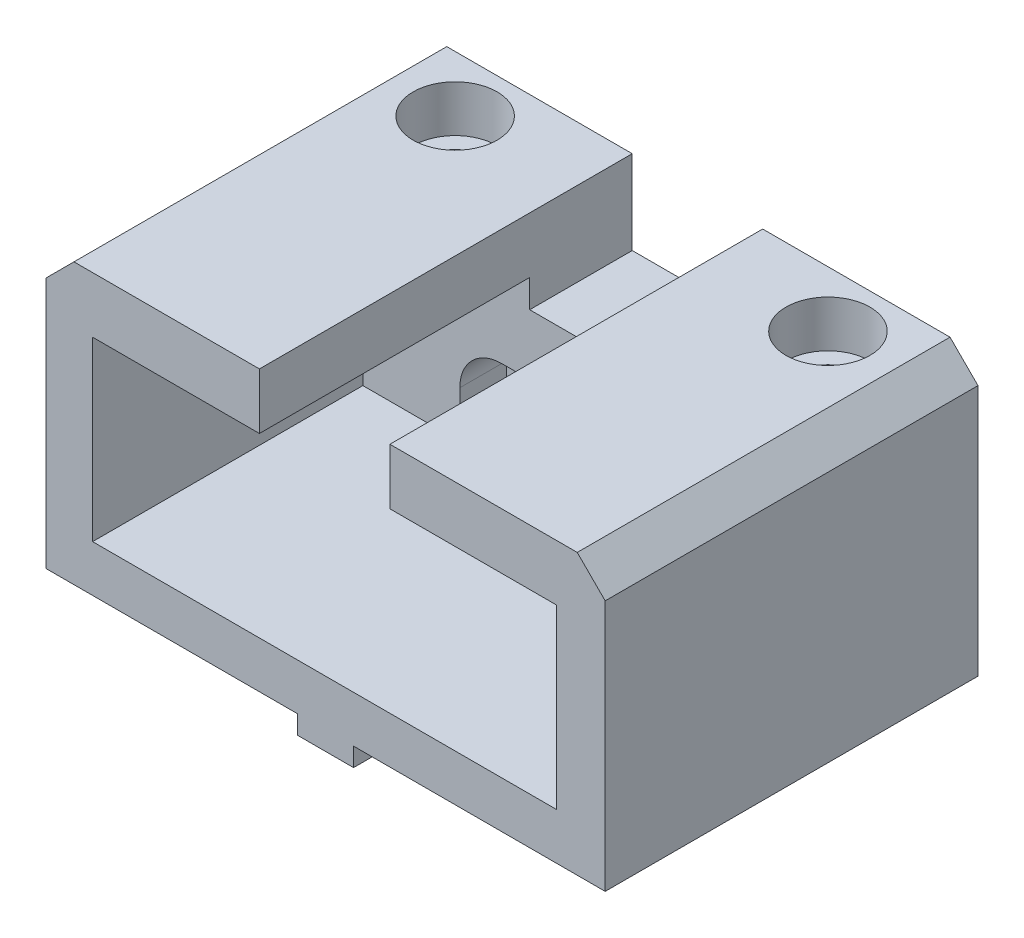
from build123d import *

# Parameters (mm, degrees)
BOSS_EXTRUDE1_DEPTH = 40
SKETCH2_R           = 2.6
BOSS_EXTRUDE2_DEPTH = 11
SKETCH3_R           = 4.5
CUT_EXTRUDE1_DEPTH  = 5
CHAMFER1_SIZE       = 3
SKETCH4_R           = 2.675
CUT_EXTRUDE5_DEPTH  = 60.413887266
SKETCH5_R           = 4.5
CUT_EXTRUDE6_DEPTH  = 5
CUT_EXTRUDE7_START  = -5
CUT_EXTRUDE7_DEPTH  = 5


# Read off the part's stored shape, not the designer's step: Cut-Extrude7
with BuildPart() as part:
    # Sketch1 → Boss-Extrude1 (new body)
    with BuildSketch(Plane.XY):
        Polygon((-29.9, 19.191927939), (-29.9, -10.808072061), (-2.9, -10.808072061), (-2.9, -12.808072061), (3.1, -12.808072061), (3.1, -10.808072061), (30.1, -10.808072061), (30.1, 19.191927939), (7, 19.191927939), (7, 13.191927939), (24.9, 13.191927939), (24.9, -5.808072061), (5.6, -5.808072061), (-5.4, -5.808072061), (-24.9, -5.808072061), (-24.9, 13.191927939), (-7, 13.191927939), (-7, 19.191927939), align=None)
    extrude(amount=BOSS_EXTRUDE1_DEPTH)

    # Sketch2 → Boss-Extrude2 (add)
    with BuildSketch(Plane(origin=(0, 0, 0), x_dir=(-1, 0, 0), z_dir=(0, 0, -1))):
        Polygon((-7, 10.191927939), (-7, 13.191927939), (-24.9, 13.191927939), (-24.9, -5.808072061), (-5.6, -5.808072061), (-5.6, -2.208368155), (-4.6, -1.208368155), (4.4, -1.208368155), (5.4, -2.208368155), (5.4, -5.808072061), (24.9, -5.808072061), (24.9, 13.191927939), (7, 13.191927939), (7, 10.191927939), align=None)
        with Locations((-10, -0.808072061)):
            Circle(SKETCH2_R, mode=Mode.SUBTRACT)
        with Locations((10, -0.808092061)):
            Circle(SKETCH2_R, mode=Mode.SUBTRACT)
    extrude(amount=-BOSS_EXTRUDE2_DEPTH)

    # Sketch3 → Cut-Extrude1 (cut)
    with BuildSketch(Plane.XY.offset(11)):
        with Locations((-10, -0.808092061)):
            Circle(SKETCH3_R)
        with Locations((10, -0.808072061)):
            Circle(SKETCH3_R)
    extrude(amount=-CUT_EXTRUDE1_DEPTH, mode=Mode.SUBTRACT)

    # Chamfer1
    chamfer1_edges = [part.edges().sort_by_distance(p)[0] for p in [
        (-29.9, 19.191927939, 20),
        (30.1, 19.191927939, 20),
    ]]
    chamfer(chamfer1_edges, length=CHAMFER1_SIZE)

    # Sketch4 → Cut-Extrude5 (cut, through all)
    with BuildSketch(Plane(origin=(0, 19.191927939, 0), x_dir=(1, 0, 0), z_dir=(0, 1, 0))):
        with Locations(Location((-20, -6, 0), (0, 0, 180))):
            Circle(SKETCH4_R)
        with Locations(Location((20, -6, 0), (0, 0, 270))):
            Circle(SKETCH4_R)
    extrude(amount=-CUT_EXTRUDE5_DEPTH, mode=Mode.SUBTRACT)

    # Sketch5 → Cut-Extrude6 (cut)
    with BuildSketch(Plane(origin=(0, 19.191927939, 0), x_dir=(1, 0, 0), z_dir=(0, 1, 0))):
        with Locations(Location((-20, -6, 0), (0, 0, 180))):
            Circle(SKETCH5_R)
        with Locations((20, -6)):
            Circle(SKETCH5_R)
    extrude(amount=-CUT_EXTRUDE6_DEPTH, mode=Mode.SUBTRACT)

    # Cut-Extrude7 outline → Cut-Extrude7 (cut)
    with BuildSketch(Plane.XY.offset(11).offset(CUT_EXTRUDE7_START)):
        with BuildLine():
            Line((9.9999955, 3.691927939), (-10.0000045, 3.691907939))
            ThreePointArc((-10.0000045, 3.691907939), (-6.818017894, -3.990070985), (-14.5, -0.808092061))
            Line((-14.5, -0.808092061), (-14.5, -5.808072061))
            Line((-14.5, -5.808072061), (-5.4, -5.808072061))
            Line((-5.4, -5.808072061), (-5.4, -2.208368155))
            Line((-5.4, -2.208368155), (-4.4, -1.208368155))
            Line((-4.4, -1.208368155), (4.6, -1.208368155))
            Line((4.6, -1.208368155), (5.6, -2.208368155))
            Line((5.6, -2.208368155), (5.6, -5.808072061))
            Line((5.6, -5.808072061), (14.5, -5.808072061))
            Line((14.5, -5.808072061), (14.5, -0.808072061))
            ThreePointArc((14.5, -0.808072061), (6.818021076, -3.990054167), (9.9999955, 3.691927939))
        make_face()
    extrude(amount=CUT_EXTRUDE7_DEPTH, mode=Mode.SUBTRACT)


solid = part.part
